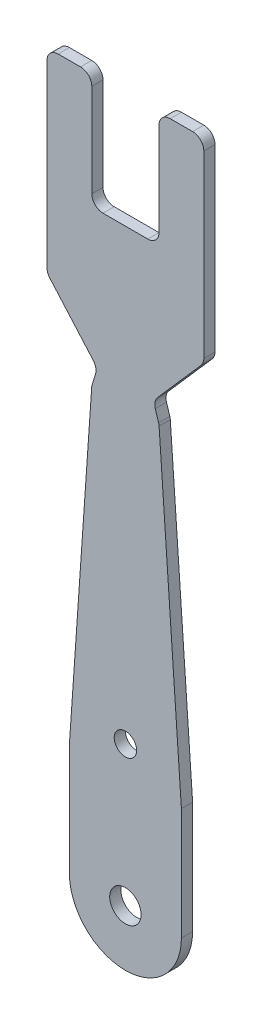
from build123d import *

# Parameters (mm, degrees)
MODEL_R           = 1.4
MODEL_R_2         = 1
BRIDA_BASE1_DEPTH = 1


# Sheet-metal steps are written as plain solids
with BuildPart() as part:
    # Model → Brida base1 (new body)
    with BuildSketch(Plane.XY):
        with BuildLine():
            Line((40.2059904, -5.7615616), (42.197855138, 22.819737764))
            ThreePointArc((42.197855138, 22.819737764), (42.212695742, 22.935208537), (42.240856149, 23.048171958))
            Line((42.240856149, 23.048171958), (42.538911562, 24.003067399))
            ThreePointArc((42.538911562, 24.003067399), (42.562673339, 24.508023196), (42.336424948, 24.960081427))
            Line((42.336424948, 24.960081427), (38.453897645, 29.390683716))
            ThreePointArc((38.453897645, 29.390683716), (38.270016908, 29.697670508), (38.2059904, 30.049740987))
            Line((38.2059904, 30.049740987), (38.2059904, 46.085251303))
            ThreePointArc((38.2059904, 46.085251303), (38.498883619, 46.792358084), (39.2059904, 47.085251303))
            Line((39.2059904, 47.085251303), (41.2059904, 47.085251303))
            ThreePointArc((41.2059904, 47.085251303), (41.913097181, 46.792358084), (42.2059904, 46.085251303))
            Line((42.2059904, 46.085251303), (42.2059904, 37.778119438))
            ThreePointArc((42.2059904, 37.778119438), (42.498883619, 37.071012657), (43.2059904, 36.778119438))
            Line((43.2059904, 36.778119438), (47.2059904, 36.778119438))
            ThreePointArc((47.2059904, 36.778119438), (47.913097181, 37.071012657), (48.2059904, 37.778119438))
            Line((48.2059904, 37.778119438), (48.2059904, 46.085251303))
            ThreePointArc((48.2059904, 46.085251303), (48.498883619, 46.792358084), (49.2059904, 47.085251303))
            Line((49.2059904, 47.085251303), (51.2059904, 47.085251303))
            ThreePointArc((51.2059904, 47.085251303), (51.913097181, 46.792358084), (52.2059904, 46.085251303))
            Line((52.2059904, 46.085251303), (52.2059904, 30.049740987))
            ThreePointArc((52.2059904, 30.049740987), (52.141963892, 29.697670508), (51.958083155, 29.390683716))
            Line((51.958083155, 29.390683716), (48.075555852, 24.960081427))
            ThreePointArc((48.075555852, 24.960081427), (47.849307461, 24.508023196), (47.873069238, 24.003067399))
            Line((47.873069238, 24.003067399), (48.171124651, 23.048171958))
            ThreePointArc((48.171124651, 23.048171958), (48.199285058, 22.935208537), (48.214125662, 22.819737764))
            Line((48.214125662, 22.819737764), (50.2059904, -5.7615616))
            Line((50.2059904, -5.7615616), (50.2059904, -15.7615616))
            ThreePointArc((50.2059904, -15.7615616), (45.2059904, -20.7615616), (40.2059904, -15.7615616))
            Line((40.2059904, -15.7615616), (40.2059904, -5.7615616))
        make_face()
        with Locations((45.2059904, -15.7615616)):
            Circle(MODEL_R, mode=Mode.SUBTRACT)
        with Locations((45.2059904, -3.2615616)):
            Circle(MODEL_R_2, mode=Mode.SUBTRACT)
    extrude(amount=-BRIDA_BASE1_DEPTH)


solid = part.part
